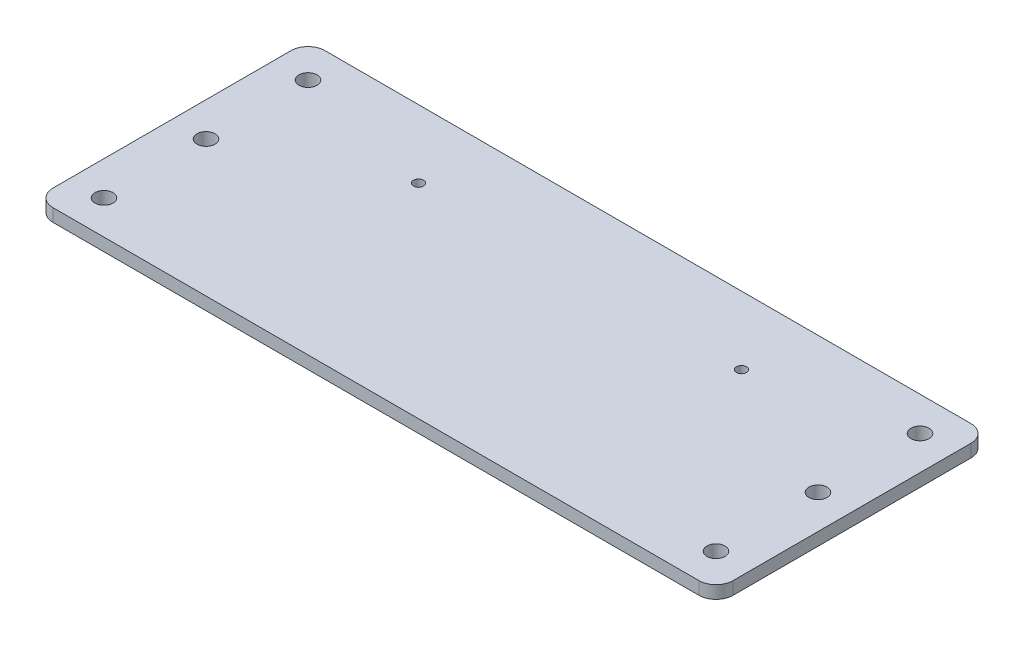
from build123d import *

# Parameters (mm, degrees)
SKETCH2_W               = 254
SKETCH2_H               = 101.6
BOSS_EXTRUDE1_DEPTH     = 4.7625
FILLET1_R               = 6.35
F_6_CLEARANCE_HOLE1_D   = 3.7973
F_1_4_CLEARANCE_HOLE1_D = 6.7564


with BuildPart() as part:
    # Sketch2 → Boss-Extrude1 (new body)
    with BuildSketch(Plane(origin=(0, 0, 0), x_dir=(1, 0, 0), z_dir=(0, 1, 0))):
        with Locations((127, -50.8)):
            Rectangle(SKETCH2_W, SKETCH2_H)
    extrude(amount=BOSS_EXTRUDE1_DEPTH)

    # Fillet1
    fillet1_edges = [part.edges().sort_by_distance(p)[0] for p in [
        (254, 2.38125, 0),
        (254, 2.38125, 101.6),
        (0, 2.38125, 101.6),
        (0, 2.38125, 0),
    ]]
    fillet(fillet1_edges, radius=FILLET1_R)

    # #6 Clearance Hole1 (through all)
    with Locations(Plane(origin=(0, 4.7625, 0), x_dir=(1, 0, 0), z_dir=(0, 1, 0))):
        with Locations((66.675, -25.4), (187.325, -25.4)):
            Hole(F_6_CLEARANCE_HOLE1_D / 2)

    # 1/4 Clearance Hole1 (through all)
    with Locations(Plane(origin=(0, 4.7625, 0), x_dir=(1, 0, 0), z_dir=(0, 1, 0))):
        with Locations((12.7, -12.7), (12.7, -88.9), (241.3, -88.9), (241.3, -12.7), (12.7, -50.8), (241.3, -50.8)):
            Hole(F_1_4_CLEARANCE_HOLE1_D / 2)


solid = part.part
